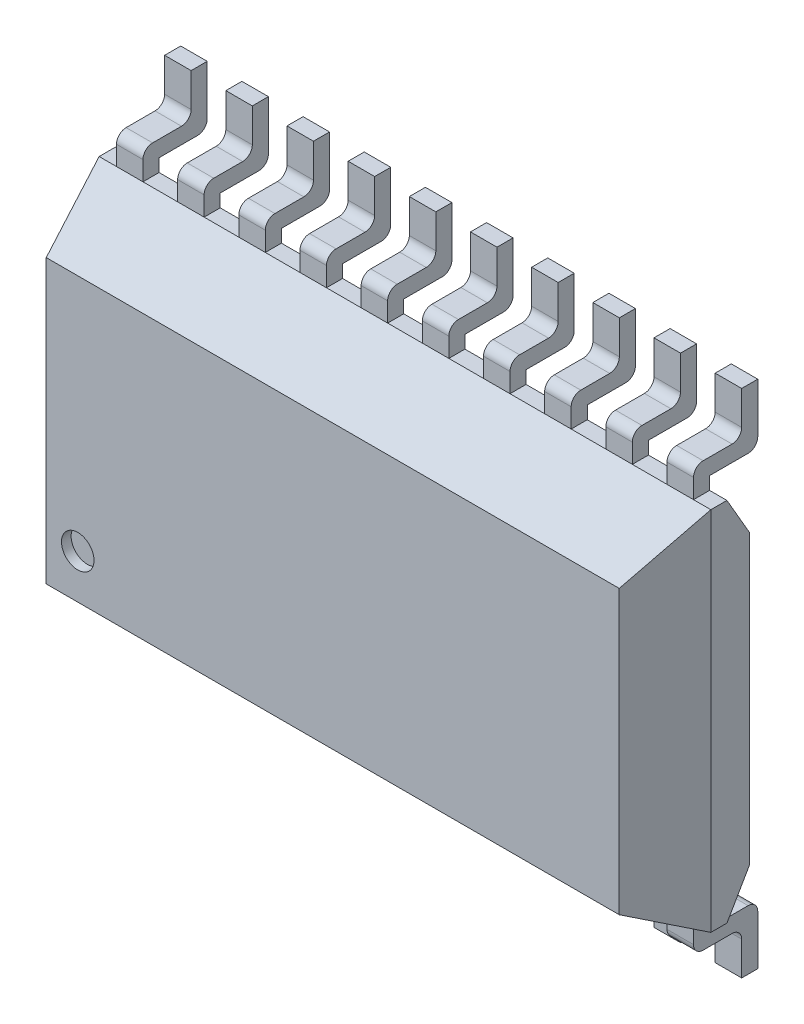
from build123d import *
from OCP.BRepFilletAPI import BRepFilletAPI_MakeChamfer

# Parameters (mm, degrees)
SKETCH_1_W                     = 12.7
SKETCH_1_H                     = 7.6
EXTRUDE_1_DEPTH                = 2.7
CHAMFER_1_SIZE                 = 1.5
CHAMFER_1_SIZE2                = 0.866025
CHAMFER_2_SIZE                 = 1.5
CHAMFER_2_SIZE2                = 0.401924
SKETCH_2_W                     = 0.55
SKETCH_2_H                     = 0.333975
FILLET_1_R                     = 0.2
PATTERN_LINEAR_1_COUNT         = 5
PATTERN_LINEAR_1_PITCH         = 1.27
FILLET_1_OF_PATTERN_LINEAR_1_R = 0.2
PATTERN_LINEAR_2_COUNT         = 6
PATTERN_LINEAR_2_PITCH         = 1.27
FILLET_1_OF_PATTERN_LINEAR_2_R = 0.2
MIRROR_START                   = 0.36
MIRROR_1_DEPTH                 = 0.55
MIRROR_START_2                 = 1.63
MIRROR_1_2_DEPTH               = 0.55
MIRROR_START_3                 = 2.9
MIRROR_1_3_DEPTH               = 0.55
MIRROR_START_4                 = 4.17
MIRROR_1_4_DEPTH               = 0.55
MIRROR_START_5                 = 5.44
MIRROR_1_5_DEPTH               = 0.55
MIRROR_START_6                 = 6.71
MIRROR_1_6_DEPTH               = 0.55
MIRROR_START_7                 = 7.98
MIRROR_1_7_DEPTH               = 0.55
MIRROR_START_8                 = 9.25
MIRROR_1_8_DEPTH               = 0.55
MIRROR_START_9                 = 10.52
MIRROR_1_9_DEPTH               = 0.55
MIRROR_START_10                = 11.79
MIRROR_1_10_DEPTH              = 0.55
SKETCH_4_R                     = 0.337581
CUT_EXTRUDE_1_DEPTH            = 0.2


# Read off the part's stored shape, not the designer's step: 镜向1
with BuildPart() as part:
    # 草图1 → 凸台-拉伸1 (new body)
    with BuildSketch(Plane.XY):
        with Locations((6.35, 3.8)):
            Rectangle(SKETCH_1_W, SKETCH_1_H)
    extrude(amount=EXTRUDE_1_DEPTH)

    # 倒角1: one chamfer whose edges measure the first distance from different faces: ONE call of the kernel's chamfer builder (chamfer() names one face for all edges)
    chamfer_1_edges_1 = [part.edges().sort_by_distance(p)[0] for p in [
        (6.35, 0, 2.7),
    ]]
    chamfer_1_side_1 = [part.faces().sort_by_distance(p)[0] for p in [
        (6.35, 0, 1.35),
    ]]
    chamfer_1_edges_2 = [part.edges().sort_by_distance(p)[0] for p in [
        (6.35, 7.6, 2.7),
    ]]
    chamfer_1_side_2 = [part.faces().sort_by_distance(p)[0] for p in [
        (6.35, 7.6, 1.35),
    ]]
    chamfer_1_edges_3 = [part.edges().sort_by_distance(p)[0] for p in [
        (6.35, 0, 0),
        (6.35, 7.6, 0),
    ]]
    chamfer_1_side_3 = [part.faces().sort_by_distance(p)[0] for p in [
        (6.35, 3.8, 0),
    ]]
    chamfer_1 = BRepFilletAPI_MakeChamfer(part.part.solid().wrapped)
    for e in chamfer_1_edges_1:
        chamfer_1.Add(CHAMFER_1_SIZE, CHAMFER_1_SIZE2, e.wrapped, chamfer_1_side_1[0].wrapped)  # the first distance lies on this face
    for e in chamfer_1_edges_2:
        chamfer_1.Add(CHAMFER_1_SIZE, CHAMFER_1_SIZE2, e.wrapped, chamfer_1_side_2[0].wrapped)  # the first distance lies on this face
    for e in chamfer_1_edges_3:
        chamfer_1.Add(CHAMFER_1_SIZE, CHAMFER_1_SIZE2, e.wrapped, chamfer_1_side_3[0].wrapped)  # the first distance lies on this face
    add(Compound.cast(chamfer_1.Shape()), mode=Mode.REPLACE)

    # 倒角2: one chamfer whose edges measure the first distance from different faces: ONE call of the kernel's chamfer builder (chamfer() names one face for all edges)
    chamfer_2_edges_1 = [part.edges().sort_by_distance(p)[0] for p in [
        (0, 3.8, 0),
        (12.7, 3.8, 0),
    ]]
    chamfer_2_side_1 = [part.faces().sort_by_distance(p)[0] for p in [
        (6.35, 3.8, 0),
    ]]
    chamfer_2_edges_2 = [part.edges().sort_by_distance(p)[0] for p in [
        (0, 3.8, 2.7),
    ]]
    chamfer_2_side_2 = [part.faces().sort_by_distance(p)[0] for p in [
        (0, 3.8, 1.365317),
    ]]
    chamfer_2_edges_3 = [part.edges().sort_by_distance(p)[0] for p in [
        (12.7, 3.8, 2.7),
    ]]
    chamfer_2_side_3 = [part.faces().sort_by_distance(p)[0] for p in [
        (12.7, 3.8, 1.365317),
    ]]
    chamfer_2 = BRepFilletAPI_MakeChamfer(part.part.solid().wrapped)
    for e in chamfer_2_edges_1:
        chamfer_2.Add(CHAMFER_2_SIZE, CHAMFER_2_SIZE2, e.wrapped, chamfer_2_side_1[0].wrapped)  # the first distance lies on this face
    for e in chamfer_2_edges_2:
        chamfer_2.Add(CHAMFER_2_SIZE, CHAMFER_2_SIZE2, e.wrapped, chamfer_2_side_2[0].wrapped)  # the first distance lies on this face
    for e in chamfer_2_edges_3:
        chamfer_2.Add(CHAMFER_2_SIZE, CHAMFER_2_SIZE2, e.wrapped, chamfer_2_side_3[0].wrapped)  # the first distance lies on this face
    add(Compound.cast(chamfer_2.Shape()), mode=Mode.REPLACE)

    # 扫描1: sweep along a path in 草图3
    with BuildLine(Plane(origin=(5.7, 0, 0), x_dir=(0, 0, -1), z_dir=(1, 0, 0))) as sweep_1_path:
        Line((-1.2, 7.6), (-1.2, 8.2))
        Line((-1.2, 8.2), (-0.2, 8.2))
        Line((-0.2, 8.2), (-0.2, 9.1))
    # 草图2 → 扫描1 (sweep)
    with BuildSketch(Plane(origin=(0, 7.6, 0), x_dir=(1, 0, 0), z_dir=(0, 1, 0))):
        with Locations((5.715, -1.033012)):
            Rectangle(SKETCH_2_W, SKETCH_2_H)
    sweep_1 = sweep(path=sweep_1_path.line, transition=Transition.RIGHT)

    # 圆角1
    fillet_1_edges = [part.edges().sort_by_distance(p)[0] for p in [
        (5.715, 7.866025, -0.133975),
        (5.715, 8.2, 0.2),
        (5.715, 8.2, 1.2),
    ]]
    fillet(fillet_1_edges, radius=FILLET_1_R)

    # 阵列(线性)1: 扫描1 ×5
    with Locations(*[(-i * PATTERN_LINEAR_1_PITCH, 0, 0) for i in range(1, PATTERN_LINEAR_1_COUNT)]):
        add(sweep_1)

    # 圆角1 of 阵列(线性)1
    fillet_1_of_pattern_linear_1_edges = [part.edges().sort_by_distance(p)[0] for p in [
        (4.445, 7.866025, -0.133975),
        (4.445, 8.2, 0.2),
        (4.445, 8.2, 1.2),
        (3.175, 7.866025, -0.133975),
        (3.175, 8.2, 0.2),
        (3.175, 8.2, 1.2),
        (1.905, 7.866025, -0.133975),
        (1.905, 8.2, 0.2),
        (1.905, 8.2, 1.2),
        (0.635, 7.866025, -0.133975),
        (0.635, 8.2, 0.2),
        (0.635, 8.2, 1.2),
    ]]
    fillet(fillet_1_of_pattern_linear_1_edges, radius=FILLET_1_OF_PATTERN_LINEAR_1_R)

    # 阵列(线性)2: 扫描1 ×6
    with Locations(*[(i * PATTERN_LINEAR_2_PITCH, 0, 0) for i in range(1, PATTERN_LINEAR_2_COUNT)]):
        add(sweep_1)

    # 圆角1 of 阵列(线性)2
    fillet_1_of_pattern_linear_2_edges = [part.edges().sort_by_distance(p)[0] for p in [
        (6.985, 7.866025, -0.133975),
        (6.985, 8.2, 0.2),
        (6.985, 8.2, 1.2),
        (8.255, 7.866025, -0.133975),
        (8.255, 8.2, 0.2),
        (8.255, 8.2, 1.2),
        (9.525, 7.866025, -0.133975),
        (9.525, 8.2, 0.2),
        (9.525, 8.2, 1.2),
        (10.795, 7.866025, -0.133975),
        (10.795, 8.2, 0.2),
        (10.795, 8.2, 1.2),
        (12.065, 7.866025, -0.133975),
        (12.065, 8.2, 0.2),
        (12.065, 8.2, 1.2),
    ]]
    fillet(fillet_1_of_pattern_linear_2_edges, radius=FILLET_1_OF_PATTERN_LINEAR_2_R)

    # 镜向1 outline → 镜向1 (add)
    with BuildSketch(Plane.YZ.offset(MIRROR_START)):
        with BuildLine():
            Line((-1.5, 0.2), (-1.5, -0.133975))
            Line((-1.5, -0.133975), (-0.466025, -0.133975))
            ThreePointArc((-0.466025, -0.133975), (-0.324604, -0.075396), (-0.266025, 0.066025))
            Line((-0.266025, 0.066025), (-0.266025, 0.866025))
            Line((-0.266025, 0.866025), (0, 0.866025))
            Line((0, 0.866025), (0, 1.2))
            Line((0, 1.2), (-0.4, 1.2))
            ThreePointArc((-0.4, 1.2), (-0.541421, 1.141421), (-0.6, 1))
            Line((-0.6, 1), (-0.6, 0.4))
            ThreePointArc((-0.6, 0.4), (-0.658579, 0.258579), (-0.8, 0.2))
            Line((-0.8, 0.2), (-1.5, 0.2))
        make_face()
    extrude(amount=MIRROR_1_DEPTH)

    # Mirror 1 2 outline → Mirror 1 2 (add)
    with BuildSketch(Plane.YZ.offset(MIRROR_START_2)):
        with BuildLine():
            Line((-1.5, 0.2), (-1.5, -0.133975))
            Line((-1.5, -0.133975), (-0.466025, -0.133975))
            ThreePointArc((-0.466025, -0.133975), (-0.324604, -0.075396), (-0.266025, 0.066025))
            Line((-0.266025, 0.066025), (-0.266025, 0.866025))
            Line((-0.266025, 0.866025), (0, 0.866025))
            Line((0, 0.866025), (0, 1.2))
            Line((0, 1.2), (-0.4, 1.2))
            ThreePointArc((-0.4, 1.2), (-0.541421, 1.141421), (-0.6, 1))
            Line((-0.6, 1), (-0.6, 0.4))
            ThreePointArc((-0.6, 0.4), (-0.658579, 0.258579), (-0.8, 0.2))
            Line((-0.8, 0.2), (-1.5, 0.2))
        make_face()
    extrude(amount=MIRROR_1_2_DEPTH)

    # Mirror 1 3 outline → Mirror 1 3 (add)
    with BuildSketch(Plane.YZ.offset(MIRROR_START_3)):
        with BuildLine():
            Line((-1.5, 0.2), (-1.5, -0.133975))
            Line((-1.5, -0.133975), (-0.466025, -0.133975))
            ThreePointArc((-0.466025, -0.133975), (-0.324604, -0.075396), (-0.266025, 0.066025))
            Line((-0.266025, 0.066025), (-0.266025, 0.866025))
            Line((-0.266025, 0.866025), (0, 0.866025))
            Line((0, 0.866025), (0, 1.2))
            Line((0, 1.2), (-0.4, 1.2))
            ThreePointArc((-0.4, 1.2), (-0.541421, 1.141421), (-0.6, 1))
            Line((-0.6, 1), (-0.6, 0.4))
            ThreePointArc((-0.6, 0.4), (-0.658579, 0.258579), (-0.8, 0.2))
            Line((-0.8, 0.2), (-1.5, 0.2))
        make_face()
    extrude(amount=MIRROR_1_3_DEPTH)

    # Mirror 1 4 outline → Mirror 1 4 (add)
    with BuildSketch(Plane.YZ.offset(MIRROR_START_4)):
        with BuildLine():
            Line((-1.5, 0.2), (-1.5, -0.133975))
            Line((-1.5, -0.133975), (-0.466025, -0.133975))
            ThreePointArc((-0.466025, -0.133975), (-0.324604, -0.075396), (-0.266025, 0.066025))
            Line((-0.266025, 0.066025), (-0.266025, 0.866025))
            Line((-0.266025, 0.866025), (0, 0.866025))
            Line((0, 0.866025), (0, 1.2))
            Line((0, 1.2), (-0.4, 1.2))
            ThreePointArc((-0.4, 1.2), (-0.541421, 1.141421), (-0.6, 1))
            Line((-0.6, 1), (-0.6, 0.4))
            ThreePointArc((-0.6, 0.4), (-0.658579, 0.258579), (-0.8, 0.2))
            Line((-0.8, 0.2), (-1.5, 0.2))
        make_face()
    extrude(amount=MIRROR_1_4_DEPTH)

    # Mirror 1 5 outline → Mirror 1 5 (add)
    with BuildSketch(Plane.YZ.offset(MIRROR_START_5)):
        with BuildLine():
            Line((-1.5, 0.2), (-1.5, -0.133975))
            Line((-1.5, -0.133975), (-0.466025, -0.133975))
            ThreePointArc((-0.466025, -0.133975), (-0.324604, -0.075396), (-0.266025, 0.066025))
            Line((-0.266025, 0.066025), (-0.266025, 0.866025))
            Line((-0.266025, 0.866025), (0, 0.866025))
            Line((0, 0.866025), (0, 1.2))
            Line((0, 1.2), (-0.4, 1.2))
            ThreePointArc((-0.4, 1.2), (-0.541421, 1.141421), (-0.6, 1))
            Line((-0.6, 1), (-0.6, 0.4))
            ThreePointArc((-0.6, 0.4), (-0.658579, 0.258579), (-0.8, 0.2))
            Line((-0.8, 0.2), (-1.5, 0.2))
        make_face()
    extrude(amount=MIRROR_1_5_DEPTH)

    # Mirror 1 6 outline → Mirror 1 6 (add)
    with BuildSketch(Plane.YZ.offset(MIRROR_START_6)):
        with BuildLine():
            Line((-1.5, 0.2), (-1.5, -0.133975))
            Line((-1.5, -0.133975), (-0.466025, -0.133975))
            ThreePointArc((-0.466025, -0.133975), (-0.324604, -0.075396), (-0.266025, 0.066025))
            Line((-0.266025, 0.066025), (-0.266025, 0.866025))
            Line((-0.266025, 0.866025), (0, 0.866025))
            Line((0, 0.866025), (0, 1.2))
            Line((0, 1.2), (-0.4, 1.2))
            ThreePointArc((-0.4, 1.2), (-0.541421, 1.141421), (-0.6, 1))
            Line((-0.6, 1), (-0.6, 0.4))
            ThreePointArc((-0.6, 0.4), (-0.658579, 0.258579), (-0.8, 0.2))
            Line((-0.8, 0.2), (-1.5, 0.2))
        make_face()
    extrude(amount=MIRROR_1_6_DEPTH)

    # Mirror 1 7 outline → Mirror 1 7 (add)
    with BuildSketch(Plane.YZ.offset(MIRROR_START_7)):
        with BuildLine():
            Line((-1.5, 0.2), (-1.5, -0.133975))
            Line((-1.5, -0.133975), (-0.466025, -0.133975))
            ThreePointArc((-0.466025, -0.133975), (-0.324604, -0.075396), (-0.266025, 0.066025))
            Line((-0.266025, 0.066025), (-0.266025, 0.866025))
            Line((-0.266025, 0.866025), (0, 0.866025))
            Line((0, 0.866025), (0, 1.2))
            Line((0, 1.2), (-0.4, 1.2))
            ThreePointArc((-0.4, 1.2), (-0.541421, 1.141421), (-0.6, 1))
            Line((-0.6, 1), (-0.6, 0.4))
            ThreePointArc((-0.6, 0.4), (-0.658579, 0.258579), (-0.8, 0.2))
            Line((-0.8, 0.2), (-1.5, 0.2))
        make_face()
    extrude(amount=MIRROR_1_7_DEPTH)

    # Mirror 1 8 outline → Mirror 1 8 (add)
    with BuildSketch(Plane.YZ.offset(MIRROR_START_8)):
        with BuildLine():
            Line((-1.5, 0.2), (-1.5, -0.133975))
            Line((-1.5, -0.133975), (-0.466025, -0.133975))
            ThreePointArc((-0.466025, -0.133975), (-0.324604, -0.075396), (-0.266025, 0.066025))
            Line((-0.266025, 0.066025), (-0.266025, 0.866025))
            Line((-0.266025, 0.866025), (0, 0.866025))
            Line((0, 0.866025), (0, 1.2))
            Line((0, 1.2), (-0.4, 1.2))
            ThreePointArc((-0.4, 1.2), (-0.541421, 1.141421), (-0.6, 1))
            Line((-0.6, 1), (-0.6, 0.4))
            ThreePointArc((-0.6, 0.4), (-0.658579, 0.258579), (-0.8, 0.2))
            Line((-0.8, 0.2), (-1.5, 0.2))
        make_face()
    extrude(amount=MIRROR_1_8_DEPTH)

    # Mirror 1 9 outline → Mirror 1 9 (add)
    with BuildSketch(Plane.YZ.offset(MIRROR_START_9)):
        with BuildLine():
            Line((-1.5, 0.2), (-1.5, -0.133975))
            Line((-1.5, -0.133975), (-0.466025, -0.133975))
            ThreePointArc((-0.466025, -0.133975), (-0.324604, -0.075396), (-0.266025, 0.066025))
            Line((-0.266025, 0.066025), (-0.266025, 0.866025))
            Line((-0.266025, 0.866025), (0, 0.866025))
            Line((0, 0.866025), (0, 1.2))
            Line((0, 1.2), (-0.4, 1.2))
            ThreePointArc((-0.4, 1.2), (-0.541421, 1.141421), (-0.6, 1))
            Line((-0.6, 1), (-0.6, 0.4))
            ThreePointArc((-0.6, 0.4), (-0.658579, 0.258579), (-0.8, 0.2))
            Line((-0.8, 0.2), (-1.5, 0.2))
        make_face()
    extrude(amount=MIRROR_1_9_DEPTH)

    # Mirror 1 10 outline → Mirror 1 10 (add)
    with BuildSketch(Plane.YZ.offset(MIRROR_START_10)):
        with BuildLine():
            Line((-1.5, 0.2), (-1.5, -0.133975))
            Line((-1.5, -0.133975), (-0.466025, -0.133975))
            ThreePointArc((-0.466025, -0.133975), (-0.324604, -0.075396), (-0.266025, 0.066025))
            Line((-0.266025, 0.066025), (-0.266025, 0.866025))
            Line((-0.266025, 0.866025), (0, 0.866025))
            Line((0, 0.866025), (0, 1.2))
            Line((0, 1.2), (-0.4, 1.2))
            ThreePointArc((-0.4, 1.2), (-0.541421, 1.141421), (-0.6, 1))
            Line((-0.6, 1), (-0.6, 0.4))
            ThreePointArc((-0.6, 0.4), (-0.658579, 0.258579), (-0.8, 0.2))
            Line((-0.8, 0.2), (-1.5, 0.2))
        make_face()
    extrude(amount=MIRROR_1_10_DEPTH)

    # 草图4 → 切除-拉伸1 (cut)
    with BuildSketch(Plane.XY.offset(2.7)):
        with Locations((1.056199, 1.782809)):
            Circle(SKETCH_4_R)
    extrude(amount=-CUT_EXTRUDE_1_DEPTH, mode=Mode.SUBTRACT)


solid = part.part
